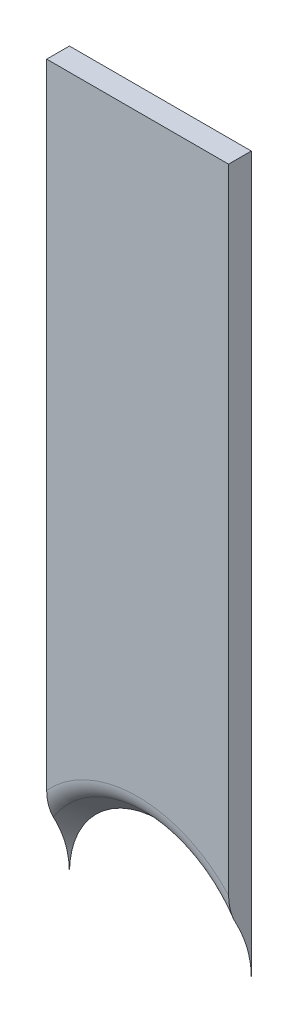
from build123d import *

# Parameters (mm, degrees)
SKETCH1_W           = 80
SKETCH1_H           = 360
BOSS_EXTRUDE1_DEPTH = 10
CUT_EXTRUDE1_DEPTH  = 10
CHAMFER2_SIZE       = 10
FILLET1_R           = 10


with BuildPart() as part:
    # Sketch1 → Boss-Extrude1 (new body)
    with BuildSketch(Plane.XY):
        Rectangle(SKETCH1_W, SKETCH1_H)
    extrude(amount=BOSS_EXTRUDE1_DEPTH)

    # Sketch2 → Cut-Extrude1 (cut)
    with BuildSketch(Plane.XY.offset(10)):
        with BuildLine():
            Line((-40, -135), (-40, -180))
            Line((-40, -180), (40, -180))
            Line((40, -180), (40, -135))
            ThreePointArc((40, -135), (0, -95), (-40, -135))
        make_face()
    extrude(amount=-CUT_EXTRUDE1_DEPTH, mode=Mode.SUBTRACT)

    # Chamfer2
    chamfer2_edges = [part.edges().sort_by_distance(p)[0] for p in [
        (0, -95, 10),
    ]]
    chamfer(chamfer2_edges, length=CHAMFER2_SIZE - 0.0001)  # a hair under: the kernel refuses the full size

    # Fillet1
    fillet1_edges = [part.edges().sort_by_distance(p)[0] for p in [
        (0, -85.0001, 10),
    ]]
    fillet(fillet1_edges, radius=FILLET1_R)


solid = part.part
